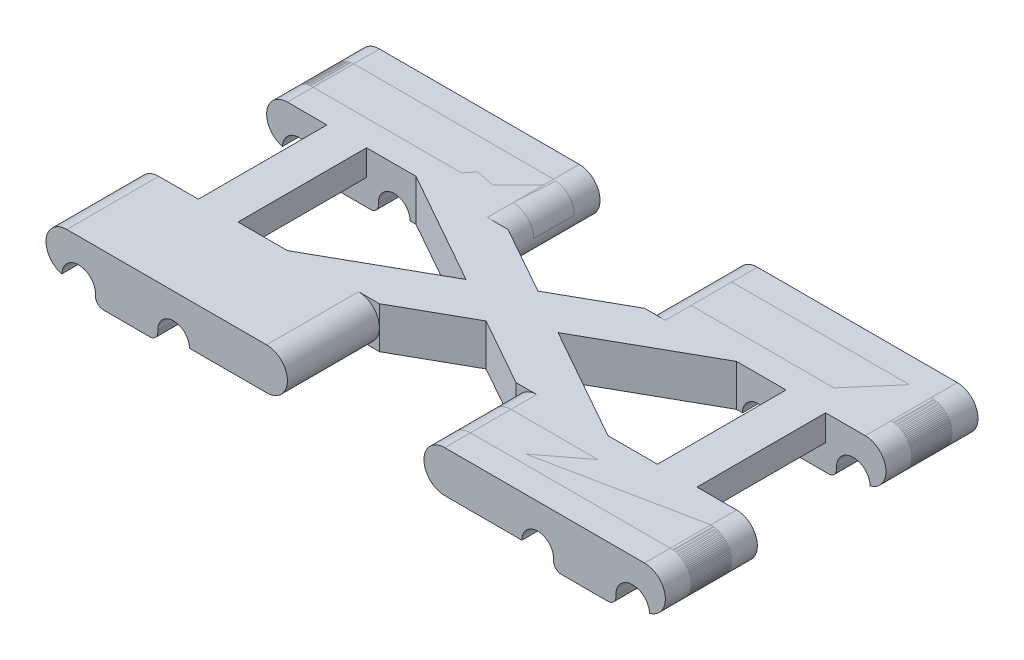
from build123d import *
from build123d.topology import SkipClean

# Parameters (mm, degrees)
BOSS_EXTRUDE9_DEPTH        = 66
BOSS_EXTRUDE9_DEPTH_BACK   = 66
SKETCH14_R                 = 2.2
BOSS_EXTRUDE9_2_DEPTH      = 66
BOSS_EXTRUDE9_2_DEPTH_BACK = 66
SKETCH16_W                 = 465.18759692
SKETCH16_H                 = 91
CUT_EXTRUDE7_DEPTH         = 172.826220351
FILLET1_R                  = 6
FILLET2_R                  = 6
FILLET3_R                  = 6
FILLET5_R                  = 6
BOSS_EXTRUDE10_DEPTH       = 13
BOSS_EXTRUDE10_DEPTH_BACK  = 145
SKETCH22_W                 = 388.002608152
SKETCH22_H                 = 65
CUT_EXTRUDE8_DEPTH         = 178.22654993
BOSS_EXTRUDE11_REACH       = 178.562
SKETCH25_W                 = 20
SKETCH25_H                 = 65
BOSS_EXTRUDE12_DEPTH       = 13


with BuildPart() as part:
    # Sketch14 → Boss-Extrude9 (new, two sides: drawn at the far end of the back side and taken through both)
    with BuildSketch(Plane.XY.offset(-BOSS_EXTRUDE9_DEPTH_BACK)):
        with BuildLine():
            Line((-146, 10.5), (-45, 10.5))
            ThreePointArc((-45, 10.5), (-34.5, 0), (-45, -10.5))
            Line((-45, -10.5), (-86, -10.5))
            Line((-86, -10.5), (-86, -15.5))
            Line((-86, -15.5), (-146, -15.5))
            Line((-146, -15.5), (-146, -10.5))
            ThreePointArc((-146, -10.5), (-156.5, 0), (-146, 10.5))
        make_face()
        with Locations((-140, -10.5)):
            Circle(SKETCH14_R, mode=Mode.SUBTRACT)
        with Locations((-92, -10.5)):
            Circle(SKETCH14_R, mode=Mode.SUBTRACT)
    extrude(amount=BOSS_EXTRUDE9_DEPTH + BOSS_EXTRUDE9_DEPTH_BACK)


with BuildPart() as body_2:
    # Sketch14 → Boss-Extrude9 2 (new, two sides: drawn at the far end of the back side and taken through both)
    with BuildSketch(Plane.XY.offset(-BOSS_EXTRUDE9_2_DEPTH_BACK)):
        with BuildLine():
            Line((146, -15.5), (146, -10.5))
            ThreePointArc((146, -10.5), (156.5, 0), (146, 10.5))
            Line((146, 10.5), (45, 10.5))
            ThreePointArc((45, 10.5), (34.5, 0), (45, -10.5))
            Line((45, -10.5), (86, -10.5))
            Line((86, -10.5), (86, -15.5))
            Line((86, -15.5), (146, -15.5))
        make_face()
        with Locations(Location((92, -10.5, 0), (0, 0, 180))):
            Circle(SKETCH14_R, mode=Mode.SUBTRACT)
        with Locations(Location((140, -10.5, 0), (0, 0, 180))):
            Circle(SKETCH14_R, mode=Mode.SUBTRACT)
    extrude(amount=BOSS_EXTRUDE9_2_DEPTH + BOSS_EXTRUDE9_2_DEPTH_BACK)


with BuildPart() as cut_extrude7_tool:
    # Sketch16 → Cut-Extrude7 (new, through all)
    with BuildSketch(Plane(origin=(0, 10.5, 0), x_dir=(1, 0, 0), z_dir=(0, 1, 0))):
        with Locations((-0.687703518, 0)):
            Rectangle(SKETCH16_W, SKETCH16_H)
    extrude(amount=-CUT_EXTRUDE7_DEPTH)


with BuildPart() as part_1:
    add(part.part)

    # Cut-Extrude7: cut by cut_extrude7_tool
    add(cut_extrude7_tool.part, mode=Mode.SUBTRACT)


with BuildPart() as body_2_1:
    add(body_2.part)

    # Cut-Extrude7: cut by cut_extrude7_tool
    add(cut_extrude7_tool.part, mode=Mode.SUBTRACT)


with BuildPart() as cut_extrude7_piece_1:
    # of the separate pieces the step leaves, piece 1, a body of its own (cut_extrude7_pieces)
    add(part_1.part.solids().sort_by_distance((-45, -10.5, -66))[0])

    # Fillet2
    # the kernel refuses this fillet: 6 mm, written as the material it takes off along each edge
    with BuildSketch(Plane(origin=(-86, -15.5, -30.709800542), x_dir=(0, 1, 0), z_dir=(0, 0, -1))) as fillet2_piece_1:
        with BuildLine():
            CenterArc((6, -5.916079783), FILLET2_R, 99.594068227, 80.405931773)
            Line((0, -5.916079783), (-0.12, -5.916079783))
            Line((-0.12, -5.916079783), (-0.12, 0))
            Line((-0.12, 0), (0, 0.12))
            ThreePointArc((0, 0.12), (2.5, 0.12), (4.98, 0.118321596))
            Line((4.98, 0.118321596), (5, 0))
        make_face()
    extrude(amount=50.080398916, mode=Mode.SUBTRACT)
    with BuildSketch(Plane(origin=(-146, -15.5, -30.709800542), x_dir=(1, 0, 0), z_dir=(0, 0, -1))) as fillet2_piece_2:
        with BuildLine():
            CenterArc((5.916079783, -6), FILLET2_R, 90, 80.405931773)
            Line((0, -5), (-0.118321596, -4.98))
            ThreePointArc((-0.118321596, -4.98), (-0.12, -2.5), (-0.12, 0))
            Line((-0.12, 0), (0, 0.12))
            Line((0, 0.12), (5.916079783, 0.12))
            Line((5.916079783, 0.12), (5.916079783, 0))
        make_face()
    extrude(amount=50.080398916, mode=Mode.SUBTRACT)


with BuildPart() as cut_extrude7_piece_2:
    # of the separate pieces the step leaves, piece 2, a body of its own (cut_extrude7_pieces)
    add(part_1.part.solids().sort_by_distance((-45, -10.5, 45.5))[0])

    # Fillet1
    # the kernel refuses this fillet: 6 mm, written as the material it takes off along each edge
    with BuildSketch(Plane(origin=(-146, -15.5, 80.790199458), x_dir=(0, 1, 0), z_dir=(0, 0, -1))) as fillet1_piece_1:
        with BuildLine():
            CenterArc((6, 5.916079783), FILLET1_R, 180, 80.405931773)
            Line((0, 5.916079783), (-0.12, 5.916079783))
            Line((-0.12, 5.916079783), (-0.12, 0))
            Line((-0.12, 0), (0, -0.12))
            ThreePointArc((0, -0.12), (2.5, -0.12), (4.98, -0.118321596))
            Line((4.98, -0.118321596), (5, 0))
        make_face()
    extrude(amount=50.080398916, mode=Mode.SUBTRACT)
    with BuildSketch(Plane(origin=(-86, -15.5, 80.790199458), x_dir=(0, 1, 0), z_dir=(0, 0, -1))) as fillet1_piece_2:
        with BuildLine():
            CenterArc((6, -5.916079783), FILLET1_R, 99.594068227, 80.405931773)
            Line((0, -5.916079783), (-0.12, -5.916079783))
            Line((-0.12, -5.916079783), (-0.12, 0))
            Line((-0.12, 0), (0, 0.12))
            ThreePointArc((0, 0.12), (2.5, 0.12), (4.98, 0.118321596))
            Line((4.98, 0.118321596), (5, 0))
        make_face()
    extrude(amount=50.080398916, mode=Mode.SUBTRACT)

    # Sketch21 → Boss-Extrude10 (add, two sides: drawn at the far end of the back side and taken through both)
    with SkipClean():  # the faces are left unmerged after this step: merging them gives an invalid solid
        with BuildSketch(Plane.XY.offset(66).offset(-BOSS_EXTRUDE10_DEPTH_BACK)):
            with BuildLine():
                Line((-131.5, -10.5), (-131.5, -11.5))
                ThreePointArc((-131.5, -11.5), (-130.328427125, -14.328427125), (-127.5, -15.5))
                Line((-127.5, -15.5), (-104, -15.5))
                ThreePointArc((-104, -15.5), (-101.171572875, -14.328427125), (-100, -11.5))
                Line((-100, -11.5), (-100, -10.5))
                ThreePointArc((-100, -10.5), (-92, -2.5), (-84, -10.5))
                Line((-84, -10.5), (-45, -10.5))
                ThreePointArc((-45, -10.5), (-34.5, 0), (-45, 10.5))
                Line((-45, 10.5), (-146, 10.5))
                ThreePointArc((-146, 10.5), (-156.424564396, 1.256366645), (-148.494680951, -10.199341496))
                ThreePointArc((-148.494680951, -10.199341496), (-139.849647225, -2.001329866), (-131.5, -10.5))
            make_face()
            with BuildLine():
                Line((45, 10.5), (146, 10.5))
                ThreePointArc((146, 10.5), (156.424564396, 1.256366645), (148.494680951, -10.199341496))
                ThreePointArc((148.494680951, -10.199341496), (139.849647225, -2.001329866), (131.5, -10.5))
                Line((131.5, -10.5), (131.5, -11.5))
                ThreePointArc((131.5, -11.5), (130.328427125, -14.328427125), (127.5, -15.5))
                Line((127.5, -15.5), (104, -15.5))
                ThreePointArc((104, -15.5), (101.171572875, -14.328427125), (100, -11.5))
                Line((100, -11.5), (100, -10.5))
                ThreePointArc((100, -10.5), (92, -2.5), (84, -10.5))
                Line((84, -10.5), (45, -10.5))
                ThreePointArc((45, -10.5), (34.5, 0), (45, 10.5))
            make_face()
        extrude(amount=BOSS_EXTRUDE10_DEPTH + BOSS_EXTRUDE10_DEPTH_BACK)


with BuildPart() as cut_extrude7_piece_1_of_body_2:
    # of the separate pieces the step leaves, piece 1, a body of its own (cut_extrude7_pieces_of_body_2)
    add(body_2_1.part.solids().sort_by_distance((146, -15.5, -45.5))[0])

    # Fillet5
    # the kernel refuses this fillet: 6 mm, written as the material it takes off along each edge
    with BuildSketch(Plane(origin=(86, -15.5, -30.709800542), x_dir=(1, 0, 0), z_dir=(0, 0, -1))) as fillet5_piece_1:
        with BuildLine():
            CenterArc((5.916079783, -6), FILLET5_R, 90, 80.405931773)
            Line((0, -5), (-0.118321596, -4.98))
            ThreePointArc((-0.118321596, -4.98), (-0.12, -2.5), (-0.12, 0))
            Line((-0.12, 0), (0, 0.12))
            Line((0, 0.12), (5.916079783, 0.12))
            Line((5.916079783, 0.12), (5.916079783, 0))
        make_face()
    extrude(amount=50.080398916, mode=Mode.SUBTRACT)
    with BuildSketch(Plane(origin=(146, -15.5, -30.709800542), x_dir=(0, 1, 0), z_dir=(0, 0, -1))) as fillet5_piece_2:
        with BuildLine():
            CenterArc((6, -5.916079783), FILLET5_R, 99.594068227, 80.405931773)
            Line((0, -5.916079783), (-0.12, -5.916079783))
            Line((-0.12, -5.916079783), (-0.12, 0))
            Line((-0.12, 0), (0, 0.12))
            ThreePointArc((0, 0.12), (2.5, 0.12), (4.98, 0.118321596))
            Line((4.98, 0.118321596), (5, 0))
        make_face()
    extrude(amount=50.080398916, mode=Mode.SUBTRACT)


with BuildPart() as cut_extrude7_piece_2_of_body_2:
    # of the separate pieces the step leaves, piece 2, a body of its own (cut_extrude7_pieces_of_body_2)
    add(body_2_1.part.solids().sort_by_distance((146, -15.5, 66))[0])

    # Fillet3
    # the kernel refuses this fillet: 6 mm, written as the material it takes off along each edge
    with BuildSketch(Plane(origin=(146, -15.5, 80.790199458), x_dir=(0, 1, 0), z_dir=(0, 0, -1))) as fillet3_piece_1:
        with BuildLine():
            CenterArc((6, -5.916079783), FILLET3_R, 99.594068227, 80.405931773)
            Line((0, -5.916079783), (-0.12, -5.916079783))
            Line((-0.12, -5.916079783), (-0.12, 0))
            Line((-0.12, 0), (0, 0.12))
            ThreePointArc((0, 0.12), (2.5, 0.12), (4.98, 0.118321596))
            Line((4.98, 0.118321596), (5, 0))
        make_face()
    extrude(amount=50.080398916, mode=Mode.SUBTRACT)
    with BuildSketch(Plane(origin=(86, -15.5, 80.790199458), x_dir=(1, 0, 0), z_dir=(0, 0, -1))) as fillet3_piece_2:
        with BuildLine():
            CenterArc((5.916079783, -6), FILLET3_R, 90, 80.405931773)
            Line((0, -5), (-0.118321596, -4.98))
            ThreePointArc((-0.118321596, -4.98), (-0.12, -2.5), (-0.12, 0))
            Line((-0.12, 0), (0, 0.12))
            Line((0, 0.12), (5.916079783, 0.12))
            Line((5.916079783, 0.12), (5.916079783, 0))
        make_face()
    extrude(amount=50.080398916, mode=Mode.SUBTRACT)


with BuildPart() as boss_extrude10_piece_1:
    # of the separate pieces the step leaves, piece 1, a body of its own (boss_extrude10_pieces)
    add(cut_extrude7_piece_2.part.solids().sort_by_distance((-84, -10.5, 45.5))[0])


with BuildPart() as boss_extrude10_piece_2:
    # of the separate pieces the step leaves, piece 2, a body of its own (boss_extrude10_pieces)
    add(cut_extrude7_piece_2.part.solids().sort_by_distance((84, -10.5, 79))[0])


with BuildPart() as cut_extrude8_tool:
    # Sketch22 → Cut-Extrude8 (new, through all)
    with SkipClean():  # the faces are left unmerged after this step: merging them gives an invalid solid
        with BuildSketch(Plane(origin=(0, 10.5, 0), x_dir=(1, 0, 0), z_dir=(0, 1, 0))):
            Rectangle(SKETCH22_W, SKETCH22_H)
        extrude(amount=-CUT_EXTRUDE8_DEPTH)


with BuildPart() as boss_extrude10_piece_1_1:
    with SkipClean():  # the faces are left unmerged after this step: merging them gives an invalid solid
        add(boss_extrude10_piece_1.part)

        # Cut-Extrude8: cut by cut_extrude8_tool
        add(cut_extrude8_tool.part, mode=Mode.SUBTRACT)


with BuildPart() as boss_extrude10_piece_2_1:
    with SkipClean():  # the faces are left unmerged after this step: merging them gives an invalid solid
        add(boss_extrude10_piece_2.part)

        # Cut-Extrude8: cut by cut_extrude8_tool
        add(cut_extrude8_tool.part, mode=Mode.SUBTRACT)


with BuildPart() as cut_extrude8_piece_1:
    # of the separate pieces the step leaves, piece 1, a body of its own (cut_extrude8_pieces)
    add(boss_extrude10_piece_1_1.part.solids().sort_by_distance((-84, -10.5, 45.5))[0])

    # Boss-Extrude11: up to this face of the body (flat: up to its plane)
    boss_extrude11_end = Plane(cut_extrude8_piece_1.part.faces().sort_by_distance((-95.5, 10.5, 55.75))[0])
    # Sketch24 → Boss-Extrude11 (add, up to the picked face)
    with BuildSketch(Plane.XZ.offset(10.5), mode=Mode.PRIVATE) as boss_extrude11_sk1:
        Polygon((81, -32.5), (23.25, 0), (81, 32.5), (34.5, 32.5), (0, 13.084415584), (-34.5, 32.5), (-81, 32.5), (-23.25, 0), (-81, -32.5), (-34.5, -32.5), (0, -13.084415584), (34.5, -32.5), align=None)
    boss_extrude11_tool1 = split(extrude(boss_extrude11_sk1.sketch, amount=-BOSS_EXTRUDE11_REACH, mode=Mode.PRIVATE), bisect_by=boss_extrude11_end, keep=Keep.BOTH, mode=Mode.PRIVATE)


with BuildPart() as cut_extrude8_piece_2:
    # of the separate pieces the step leaves, piece 2, a body of its own (cut_extrude8_pieces)
    add(boss_extrude10_piece_1_1.part.solids().sort_by_distance((-84, -10.5, -79))[0])


with BuildPart() as cut_extrude8_piece_1_of_boss_extrude10_p:
    # of the separate pieces the step leaves, piece 1, a body of its own (cut_extrude8_pieces_of_boss_extrude10_pi)
    add(boss_extrude10_piece_2_1.part.solids().sort_by_distance((84, -10.5, -79))[0])


with BuildPart() as cut_extrude8_piece_2_of_boss_extrude10_p:
    # of the separate pieces the step leaves, piece 2, a body of its own (cut_extrude8_pieces_of_boss_extrude10_pi)
    add(boss_extrude10_piece_2_1.part.solids().sort_by_distance((84, -10.5, 32.5))[0])


with BuildPart() as cut_extrude8_piece_1_1:
    add(cut_extrude8_piece_1.part)

    add(cut_extrude8_piece_2.part)  # Boss-Extrude11 merges Cut-Extrude8 piece 2

    add(cut_extrude8_piece_1_of_boss_extrude10_p.part)  # Boss-Extrude11 merges Cut-Extrude8 piece 1 of Boss-Extrude10 p

    add(cut_extrude8_piece_2_of_boss_extrude10_p.part)  # Boss-Extrude11 merges Cut-Extrude8 piece 2 of Boss-Extrude10 p
    add(boss_extrude11_tool1.solids().sort_by(Axis((0, -10.5, 0), (0, 1, 0)))[0])

    # Sketch25 → Boss-Extrude12 (add)
    with SkipClean():  # the faces are left unmerged after this step: merging them gives an invalid solid
        with BuildSketch(Plane(origin=(0, 10.5, 0), x_dir=(1, 0, 0), z_dir=(0, 1, 0))):
            with Locations((-116, 0)):
                Rectangle(SKETCH25_W, SKETCH25_H)
            with Locations((116, 0)):
                Rectangle(SKETCH25_W, SKETCH25_H)
        extrude(amount=-BOSS_EXTRUDE12_DEPTH)


solid = Compound([cut_extrude7_piece_1.part, cut_extrude7_piece_1_of_body_2.part, cut_extrude7_piece_2_of_body_2.part, cut_extrude8_piece_1_1.part])
